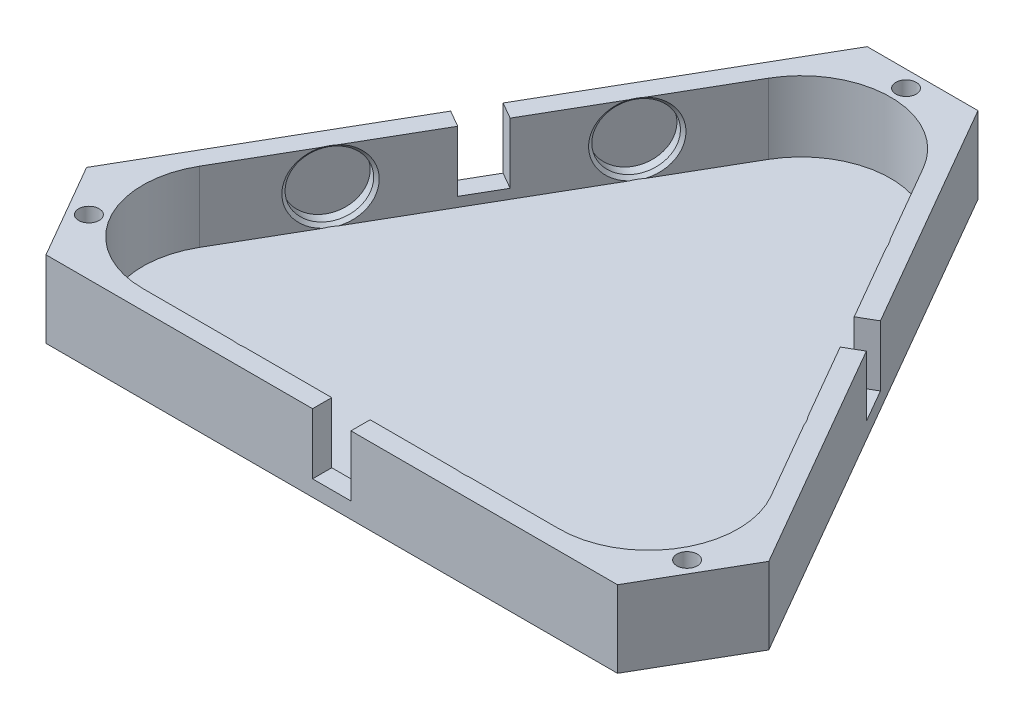
from build123d import *

# Parameters (mm, degrees)
BOSS_EXTRU_1_DEPTH           = 12
ESQUISSE10_R                 = 1.6
ENL_V_MAT_EXTRU_6_DEPTH      = 96.463780217
ENL_V_MAT_EXTRU_1_DEPTH      = 96.463780217
ENL_V_MAT_EXTRU_2_DEPTH      = 11
ESQUISSE4_W                  = 6
ESQUISSE4_H                  = 3
ENL_V_MAT_EXTRU_3_DEPTH      = 9.5
ESQUISSE11_R                 = 5.075
ENL_V_MAT_EXTRU_7_DEPTH      = 2
R_P_TITION_CIRCULAIRE1_COUNT = 3
CHANFREIN1_SIZE              = 0.5


with BuildPart() as part:
    # Esquisse1 → Boss.-Extru.1 (new body)
    with BuildSketch(Plane(origin=(0, 0, 0), x_dir=(1, 0, 0), z_dir=(0, 1, 0))):
        Polygon((-62, -35.79571669), (62, -35.79571669), (0, 71.59143338), align=None)
    extrude(amount=BOSS_EXTRU_1_DEPTH)

    # Esquisse10 → Enlèv. mat.-Extru.6 (cut, through all)
    with BuildSketch(Plane(origin=(0, 12, 0), x_dir=(1, 0, 0), z_dir=(0, 1, 0))):
        with Locations(Location((0, 54, 0), (0, 0, 270))):
            Circle(ESQUISSE10_R)
        with Locations(Location((46.765371804, -27, 0), (0, 0, 270))):
            Circle(ESQUISSE10_R)
        with Locations(Location((-46.765371804, -27, 0), (0, 0, 270))):
            Circle(ESQUISSE10_R)
    extrude(amount=-ENL_V_MAT_EXTRU_6_DEPTH, mode=Mode.SUBTRACT)

    # Esquisse2 → Enlèv. mat.-Extru.1 (cut, through all)
    with BuildSketch(Plane(origin=(0, 12, 0), x_dir=(1, 0, 0), z_dir=(0, 1, 0))):
        Polygon((-8.660254038, 56.59143338), (8.660254038, 56.59143338), (0, 71.59143338), align=None)
        Polygon((62, -35.79571669), (53.339745962, -20.79571669), (44.679491924, -35.79571669), align=None)
        Polygon((-62, -35.79571669), (-44.679491924, -35.79571669), (-53.339745962, -20.79571669), align=None)
    extrude(amount=-ENL_V_MAT_EXTRU_1_DEPTH, mode=Mode.SUBTRACT)

    # Esquisse3 → Enlèv. mat.-Extru.2 (cut)
    with BuildSketch(Plane(origin=(0, 12, 0), x_dir=(1, 0, 0), z_dir=(0, 1, 0))):
        with BuildLine():
            Line((44.679491924, -11.79571669), (12.124355653, 44.59143338))
            ThreePointArc((12.124355653, 44.59143338), (0, 51.59143338), (-12.124355653, 44.59143338))
            Line((-12.124355653, 44.59143338), (-44.679491924, -11.79571669))
            ThreePointArc((-44.679491924, -11.79571669), (-44.679491924, -25.79571669), (-32.555136271, -32.79571669))
            Line((-32.555136271, -32.79571669), (32.555136271, -32.79571669))
            ThreePointArc((32.555136271, -32.79571669), (44.679491924, -25.79571669), (44.679491924, -11.79571669))
        make_face()
    extrude(amount=-ENL_V_MAT_EXTRU_2_DEPTH, mode=Mode.SUBTRACT)

    # Esquisse4 → Enlèv. mat.-Extru.3 (cut)
    with BuildSketch(Plane(origin=(0, 12, 0), x_dir=(1, 0, 0), z_dir=(0, 1, 0))):
        Polygon((29.901923789, 13.799782134), (26.901923789, 18.995934556), (29.5, 20.495934556), (32.5, 15.299782134), align=None)
        with Locations((0, -34.29571669)):
            Rectangle(ESQUISSE4_W, ESQUISSE4_H)
        Polygon((-29.5, 20.495934556), (-26.901923789, 18.995934556), (-29.901923789, 13.799782134), (-32.5, 15.299782134), align=None)
    extrude(amount=-ENL_V_MAT_EXTRU_3_DEPTH, mode=Mode.SUBTRACT)

    # Esquisse11 → Enlèv. mat.-Extru.7 (cut)
    with BuildSketch(Plane(origin=(0, 0, 32.79571669), x_dir=(-1, 0, 0), z_dir=(0, 0, -1))):
        with Locations((-17.555136271, 6.5)):
            Circle(ESQUISSE11_R)
        with Locations(Location((17.555136271, 6.5, 0), (0, 0, 180))):
            Circle(ESQUISSE11_R)
    enl_v_mat_extru_7 = extrude(amount=-ENL_V_MAT_EXTRU_7_DEPTH, mode=Mode.SUBTRACT)

    # Répétition circulaire1: Enlèv. mat.-Extru.7 ×3 about axis
    r_p_tition_circulaire1_axis = Axis((0, 0, 0), (0, 1, 0))
    for i in range(1, R_P_TITION_CIRCULAIRE1_COUNT):
        add(enl_v_mat_extru_7.rotate(r_p_tition_circulaire1_axis, i * 360 / R_P_TITION_CIRCULAIRE1_COUNT), mode=Mode.SUBTRACT)

    # Chanfrein1
    # the kernel refuses this chamfer: 0.5 mm, written as the material it takes off along each edge
    with BuildSketch(Plane(origin=(17.555136271, 6.5, 32.79571669), x_dir=(-1, 0, 0), z_dir=(0, -1, 0))) as chanfrein1_piece_1_section:
        Polygon((5.075 + CHANFREIN1_SIZE, 0), (5.075, -CHANFREIN1_SIZE), (5.075, 0), align=None)
    chanfrein1_piece_1 = revolve(axis=Axis((17.555136271, 6.5, 32.79571669), (0, 0, -1)), mode=Mode.PRIVATE)
    chanfrein1_piece_1 = split(chanfrein1_piece_1, bisect_by=Plane(origin=(22.868441697, 1, 33.034022115), z_dir=(0, 1, 0)), keep=Keep.TOP, mode=Mode.PRIVATE)
    add(chanfrein1_piece_1, mode=Mode.SUBTRACT)
    with BuildSketch(Plane(origin=(-17.555136271, 6.5, 32.79571669), x_dir=(1, 0, 0), z_dir=(0, 1, 0))) as chanfrein1_piece_2_section:
        Polygon((5.075 + CHANFREIN1_SIZE, 0), (5.075, -CHANFREIN1_SIZE), (5.075, 0), align=None)
    chanfrein1_piece_2 = revolve(axis=Axis((-17.555136271, 6.5, 32.79571669), (0, 0, -1)), mode=Mode.PRIVATE)
    chanfrein1_piece_2 = split(chanfrein1_piece_2, bisect_by=Plane(origin=(-22.868441724, 1, 33.034022142), z_dir=(0, 1, 0)), keep=Keep.TOP, mode=Mode.PRIVATE)
    add(chanfrein1_piece_2, mode=Mode.SUBTRACT)
    with BuildSketch(Plane(origin=(-19.624355653, 6.5, -31.601052323), x_dir=(-0.5000000000000007, 0, 0.8660254037844384), z_dir=(0, 1, 0))) as chanfrein1_piece_3_section:
        Polygon((5.075 + CHANFREIN1_SIZE, 0), (5.075, -CHANFREIN1_SIZE), (5.075, 0), align=None)
    chanfrein1_piece_3 = revolve(axis=Axis((-19.624355653, 6.5, -31.601052323), (0.8660254037844384, 0, 0.5000000000000004)), mode=Mode.PRIVATE)
    chanfrein1_piece_3 = split(chanfrein1_piece_3, bisect_by=Plane(origin=(-17.174081503, 1, -36.32166255), z_dir=(0, 1, 0)), keep=Keep.TOP, mode=Mode.PRIVATE)
    add(chanfrein1_piece_3, mode=Mode.SUBTRACT)
    with BuildSketch(Plane(origin=(-37.179491924, 6.5, -1.194664367), x_dir=(0.4999999999999994, 0, -0.866025403784439), z_dir=(0, -1, 0))) as chanfrein1_piece_4_section:
        Polygon((5.075 + CHANFREIN1_SIZE, 0), (5.075, -CHANFREIN1_SIZE), (5.075, 0), align=None)
    chanfrein1_piece_4 = revolve(axis=Axis((-37.179491924, 6.5, -1.194664367), (0.8660254037844384, 0, 0.5000000000000004)), mode=Mode.PRIVATE)
    chanfrein1_piece_4 = split(chanfrein1_piece_4, bisect_by=Plane(origin=(-40.04252319, 1, 3.287640397), z_dir=(0, 1, 0)), keep=Keep.TOP, mode=Mode.PRIVATE)
    add(chanfrein1_piece_4, mode=Mode.SUBTRACT)
    with BuildSketch(Plane(origin=(37.179491924, 6.5, -1.194664367), x_dir=(-0.4999999999999992, 0, -0.866025403784439), z_dir=(0, 1, 0))) as chanfrein1_piece_5_section:
        Polygon((5.075 + CHANFREIN1_SIZE, 0), (5.075, -CHANFREIN1_SIZE), (5.075, 0), align=None)
    chanfrein1_piece_5 = revolve(axis=Axis((37.179491924, 6.5, -1.194664367), (-0.8660254037844388, 0, 0.49999999999999983)), mode=Mode.PRIVATE)
    chanfrein1_piece_5 = split(chanfrein1_piece_5, bisect_by=Plane(origin=(40.042523227, 1, 3.287640407), z_dir=(0, 1, 0)), keep=Keep.TOP, mode=Mode.PRIVATE)
    add(chanfrein1_piece_5, mode=Mode.SUBTRACT)
    with BuildSketch(Plane(origin=(19.624355653, 6.5, -31.601052323), x_dir=(0.4999999999999997, 0, 0.8660254037844387), z_dir=(0, -1, 0))) as chanfrein1_piece_6_section:
        Polygon((5.075 + CHANFREIN1_SIZE, 0), (5.075, -CHANFREIN1_SIZE), (5.075, 0), align=None)
    chanfrein1_piece_6 = revolve(axis=Axis((19.624355653, 6.5, -31.601052323), (-0.8660254037844388, 0, 0.49999999999999983)), mode=Mode.PRIVATE)
    chanfrein1_piece_6 = split(chanfrein1_piece_6, bisect_by=Plane(origin=(17.174081493, 1, -36.321662513), z_dir=(0, 1, 0)), keep=Keep.TOP, mode=Mode.PRIVATE)
    add(chanfrein1_piece_6, mode=Mode.SUBTRACT)


solid = part.part
